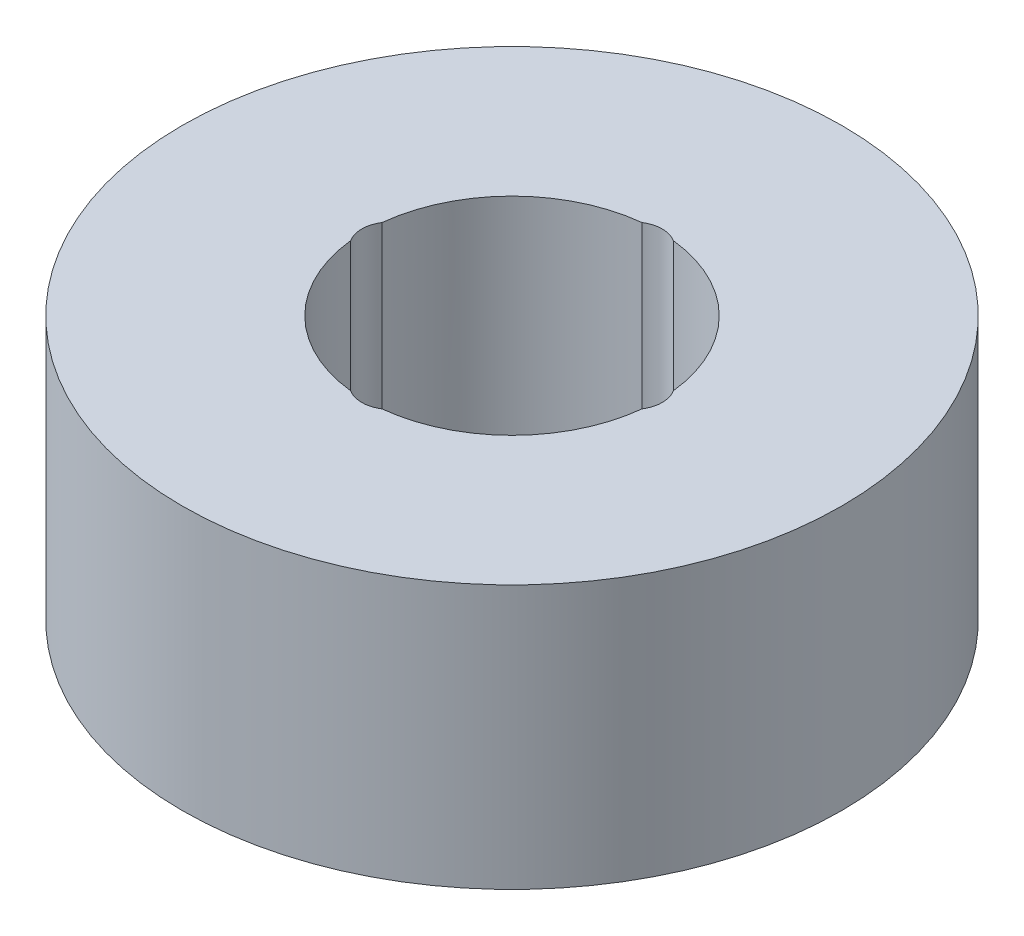
from build123d import *

# Parameters (mm, degrees)
SKETCH1_R           = 22.5
BOSS_EXTRUDE1_DEPTH = 18
SKETCH2_R           = 10
CUT_EXTRUDE1_DEPTH  = 37.558172821
SKETCH3_R           = 1.998354334
CUT_EXTRUDE2_DEPTH  = 14.282237727
CIRPATTERN1_COUNT   = 4


with BuildPart() as part:
    # Sketch1 → Boss-Extrude1 (new body)
    with BuildSketch(Plane(origin=(0, 0, 0), x_dir=(1, 0, 0), z_dir=(0, 1, 0))):
        Circle(SKETCH1_R)
    extrude(amount=BOSS_EXTRUDE1_DEPTH)

    # Sketch2 → Cut-Extrude1 (cut, through all)
    with BuildSketch(Plane(origin=(0, 0, 0), x_dir=(1, 0, 0), z_dir=(0, 1, 0))):
        Circle(SKETCH2_R)
    extrude(amount=CUT_EXTRUDE1_DEPTH, mode=Mode.SUBTRACT)

    # Sketch3 → Cut-Extrude2 (cut)
    with BuildSketch(Plane(origin=(0, 18, 0), x_dir=(1, 0, 0), z_dir=(0, 1, 0))):
        with Locations((-8.255907584, 0)):
            Circle(SKETCH3_R)
    cut_extrude2 = extrude(amount=-CUT_EXTRUDE2_DEPTH, mode=Mode.SUBTRACT)

    # CirPattern1: Cut-Extrude2 ×4 about axis
    cirpattern1_axis = Axis((0, 0, 0), (0, 1, 0))
    for i in range(1, CIRPATTERN1_COUNT):
        add(cut_extrude2.rotate(cirpattern1_axis, i * 360 / CIRPATTERN1_COUNT), mode=Mode.SUBTRACT)


solid = part.part
